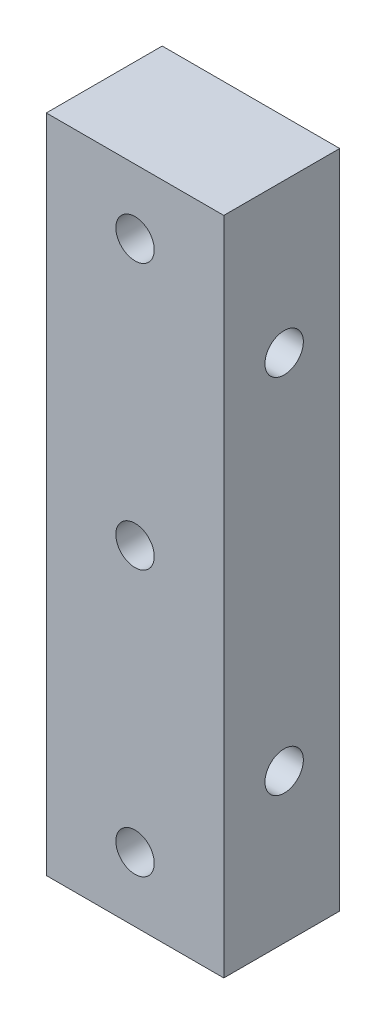
from build123d import *

# Parameters (mm, degrees)
SKETCH1_W                  = 18.669
SKETCH1_H                  = 69.469
BOSS_EXTRUDE1_DEPTH        = 12.192
TAP_DRILL_FOR_10_32_TAP1_D = 4.0386
TAP_DRILL_FOR_10_32_TAP2_D = 4.0386


with BuildPart() as part:
    # Sketch1 → Boss-Extrude1 (new body)
    with BuildSketch(Plane.XY):
        Rectangle(SKETCH1_W, SKETCH1_H)
    extrude(amount=BOSS_EXTRUDE1_DEPTH)

    # Tap Drill for #10-32 Tap1 (through all)
    with Locations(Plane(origin=(9.3345, 0, 0), x_dir=(0, 0, -1), z_dir=(1, 0, 0))):
        with Locations((-5.842, 19.05), (-5.842, -19.05)):
            Hole(TAP_DRILL_FOR_10_32_TAP1_D / 2)

    # Tap Drill for #10-32 Tap2 (through all)
    with Locations(Plane.XY.offset(12.192)):
        with Locations((0, 27.94), (0, -27.94), (0, 0)):
            Hole(TAP_DRILL_FOR_10_32_TAP2_D / 2)


solid = part.part
